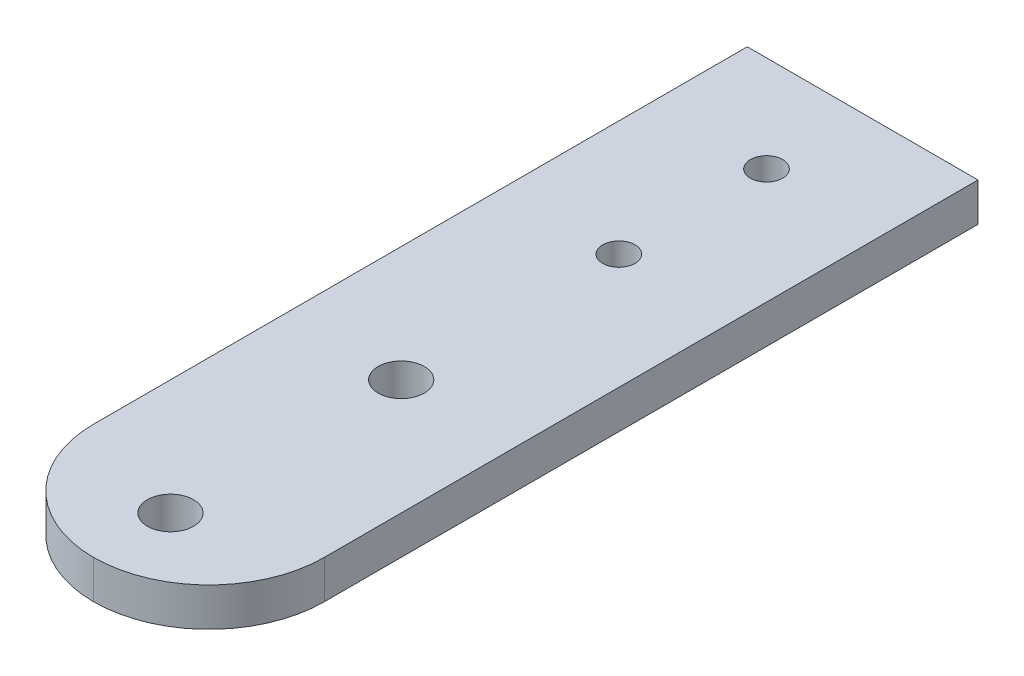
from build123d import *

# Parameters (mm, degrees)
ESQUISSE1_W                = 15
ESQUISSE1_H                = 2.5
EXTRUSION1_DEPTH           = 50
ESQUISSE2_R                = 1.5
EXTRUSION2_DEPTH           = 51.621141828
R_P_TITION_LIN_AIRE1_COUNT = 2
R_P_TITION_LIN_AIRE1_PITCH = 15
CONG_1_R                   = 7.5
ESQUISSE5_R                = 1.05
ENL_V_MAT_EXTRU_3_DEPTH    = 10
ESQUISSE6_R                = 1.05
ENL_V_MAT_EXTRU_4_DEPTH    = 10


with BuildPart() as part:
    # Esquisse1 → Extrusion1 (new body)
    with BuildSketch(Plane.XY):
        Rectangle(ESQUISSE1_W, ESQUISSE1_H)
    extrude(amount=EXTRUSION1_DEPTH)

    # Esquisse2 → Extrusion2 (cut, through all)
    with BuildSketch(Plane(origin=(0, 1.25, 0), x_dir=(1, 0, 0), z_dir=(0, 1, 0))):
        with Locations(Location((0, -45, 0), (0, 0, 270))):
            Circle(ESQUISSE2_R)
    extrusion2 = extrude(amount=-EXTRUSION2_DEPTH, mode=Mode.SUBTRACT)

    # Répétition linéaire1: Extrusion2 ×2
    with Locations(*[(0, 0, -i * R_P_TITION_LIN_AIRE1_PITCH) for i in range(1, R_P_TITION_LIN_AIRE1_COUNT)]):
        add(extrusion2, mode=Mode.SUBTRACT)

    # Congé1
    cong_1_edges = [part.edges().sort_by_distance(p)[0] for p in [
        (-7.5, 0, 50),
        (7.5, 0, 50),
    ]]
    fillet(cong_1_edges, radius=CONG_1_R - 0.0001)  # a hair under: the kernel refuses the full size

    # Esquisse5 → Enlèv. mat.-Extru.3 (cut)
    with BuildSketch(Plane(origin=(0, 1.25, 0), x_dir=(-1, 0, 0), z_dir=(0, 1, 0))):
        with Locations(Location((0, 6.249569422, 0), (0, 0, 90))):
            Circle(ESQUISSE5_R)
    extrude(amount=-ENL_V_MAT_EXTRU_3_DEPTH, mode=Mode.SUBTRACT)

    # Esquisse6 → Enlèv. mat.-Extru.4 (cut)
    with BuildSketch(Plane(origin=(0, 1.25, 0), x_dir=(1, 0, 0), z_dir=(0, 1, 0))):
        with Locations(Location((0, -15.849569422, 0), (0, 0, 270))):
            Circle(ESQUISSE6_R)
    extrude(amount=-ENL_V_MAT_EXTRU_4_DEPTH, mode=Mode.SUBTRACT)


solid = part.part
